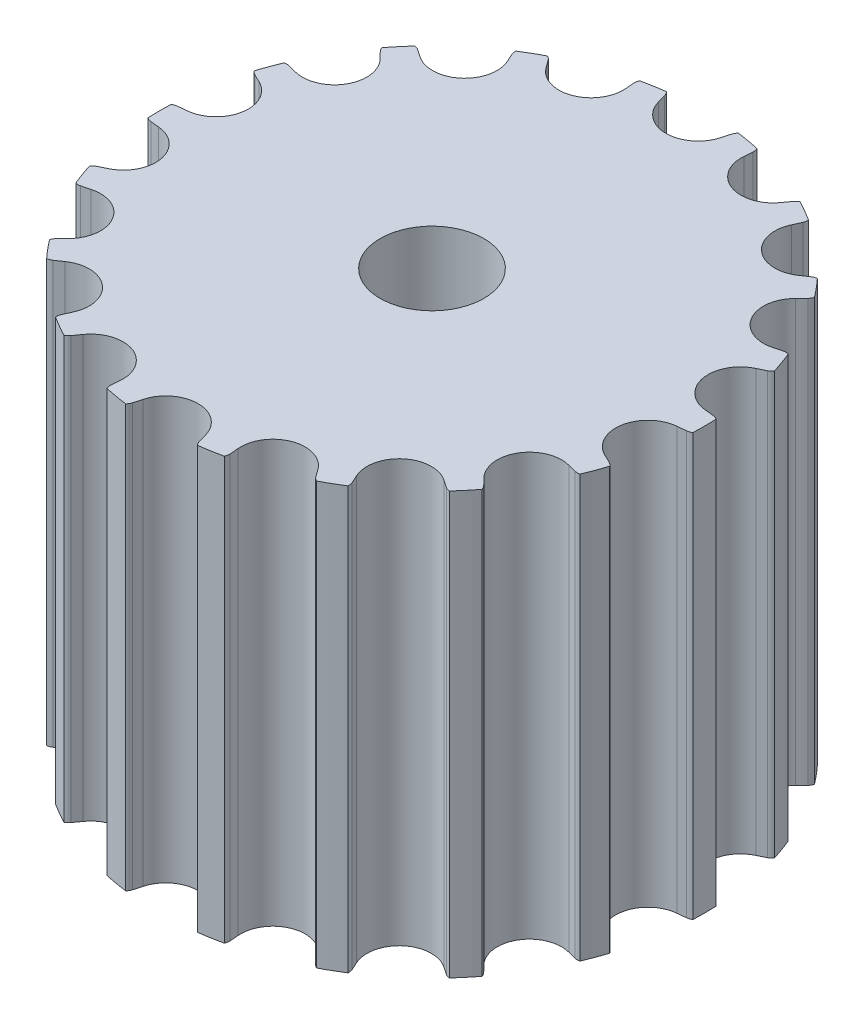
from build123d import *

# Parameters (mm, degrees)
SKETCH1_R               = 8.213367202
TOOTHOD_DEPTH           = 6.35
TOOTHPROFILE_DEPTH      = 14.237873756
TOOTHPATTERN_COUNT      = 18
BORE_DEPTH              = 17.053636259
BORE_DEPTH_BACK         = 17.053636259
SKETCH7_R               = 1.5625
CUT_EXTRUDE2_DEPTH      = 17.053636259
CUT_EXTRUDE2_DEPTH_BACK = 17.053636259
SKETCH11_W              = 19.982734404
SKETCH11_H              = 1.27


with BuildPart() as part:
    # Sketch1 → ToothOD (new, symmetric)
    with BuildSketch(Plane(origin=(0, 0, 0), x_dir=(1, 0, 0), z_dir=(0, 1, 0))):
        Circle(SKETCH1_R)
    extrude(amount=TOOTHOD_DEPTH, both=True)

    # Sketch2 → ToothProfile (cut, symmetric)
    with BuildSketch(Plane(origin=(0, 0, 0), x_dir=(1, 0, 0), z_dir=(0, 1, 0))):
        with BuildLine():
            ThreePointArc((-0.937033068, 7.763429198), (-0.590385173, 7.245254588), (0, 7.044967202))
            ThreePointArc((0, 7.044967202), (0.590385173, 7.245254588), (0.937033068, 7.763429198))
            ThreePointArc((0.937033068, 7.763429198), (0.971699064, 7.88954066), (1.007805813, 8.015247202))
            ThreePointArc((1.007805813, 8.015247202), (1.037242296, 8.083128985), (1.082411127, 8.141731201))
            ThreePointArc((1.082411127, 8.141731201), (0, 8.213367202), (-1.082411127, 8.141731201))
            ThreePointArc((-1.082411127, 8.141731201), (-1.037242296, 8.083128985), (-1.007805813, 8.015247202))
            ThreePointArc((-1.007805813, 8.015247202), (-0.971699064, 7.88954066), (-0.937033068, 7.763429198))
        make_face()
    toothprofile = extrude(amount=TOOTHPROFILE_DEPTH, both=True, mode=Mode.SUBTRACT)

    # ToothPattern: ToothProfile ×18 about axis
    toothpattern_axis = Axis((0, 6.35, 0), (0, -1, 0))
    for i in range(1, TOOTHPATTERN_COUNT):
        add(toothprofile.rotate(toothpattern_axis, i * 360 / TOOTHPATTERN_COUNT), mode=Mode.SUBTRACT)

    # Sketch4 → Flange (revolve)
    with BuildSketch(Plane.XY):
        with BuildLine():
            Line((0, -6.35), (8.467367202, -6.35))
            ThreePointArc((8.467367202, -6.35), (8.697013823, -6.385951298), (8.92243953, -6.442637424))
            ThreePointArc((8.92243953, -6.442637424), (9.490168107, -6.724197125), (9.991367202, -7.112))
            Line((9.991367202, -7.112), (9.991367202, -7.62))
            Line((9.991367202, -7.62), (0, -7.62))
            Line((0, -7.62), (0, -6.35))
        make_face()
        with BuildLine():
            Line((9.991367202, 7.62), (9.991367202, 7.112))
            ThreePointArc((9.991367202, 7.112), (9.490168107, 6.724197125), (8.92243953, 6.442637424))
            ThreePointArc((8.92243953, 6.442637424), (8.697013823, 6.385951298), (8.467367202, 6.35))
            Line((8.467367202, 6.35), (0, 6.35))
            Line((0, 6.35), (0, 7.62))
            Line((0, 7.62), (9.991367202, 7.62))
        make_face()
    revolve(axis=Axis((0, 8.73125, 0), (0, -1, 0)))

    # Sketch7 → Bore (cut, two sides: drawn at the far end of the back side and taken through both)
    with BuildSketch(Plane.XZ.offset(-BORE_DEPTH_BACK)):
        Circle(SKETCH7_R)
    extrude(amount=BORE_DEPTH + BORE_DEPTH_BACK, mode=Mode.SUBTRACT)

    # Sketch11 → Cut-Extrude2 (cut, two sides: drawn at the far end of the back side and taken through both)
    with BuildSketch(Plane.XY.offset(-CUT_EXTRUDE2_DEPTH_BACK)):
        with Locations((0, 6.985)):
            Rectangle(SKETCH11_W, SKETCH11_H)
        with Locations((0, -6.985)):
            Rectangle(SKETCH11_W, SKETCH11_H)
    extrude(amount=CUT_EXTRUDE2_DEPTH + CUT_EXTRUDE2_DEPTH_BACK, mode=Mode.SUBTRACT)


solid = part.part
